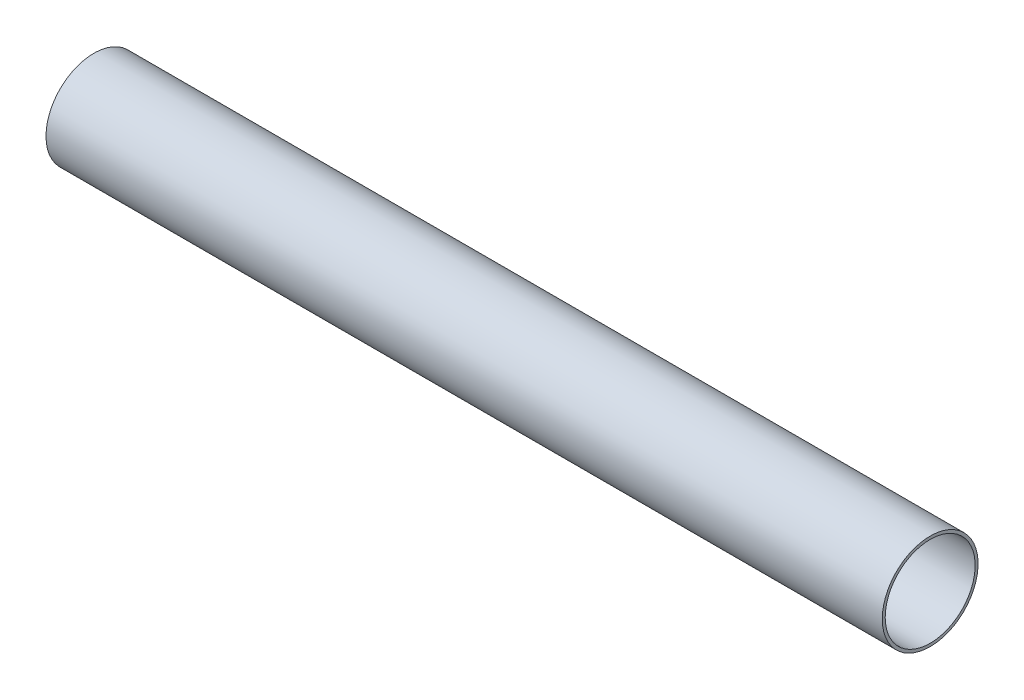
from build123d import *

# Parameters (mm, degrees)
SKETCH1_R      = 17.4625
SKETCH1_R_2    = 16.3957
EXTRUDE1_DEPTH = 152.4


with BuildPart() as part:
    # Sketch1 → Extrude1 (new, symmetric)
    with BuildSketch(Plane(origin=(0, 0, 0), x_dir=(0, 0, -1), z_dir=(1, 0, 0))):
        Circle(SKETCH1_R)
        Circle(SKETCH1_R_2, mode=Mode.SUBTRACT)
    extrude(amount=EXTRUDE1_DEPTH, both=True)


solid = part.part
